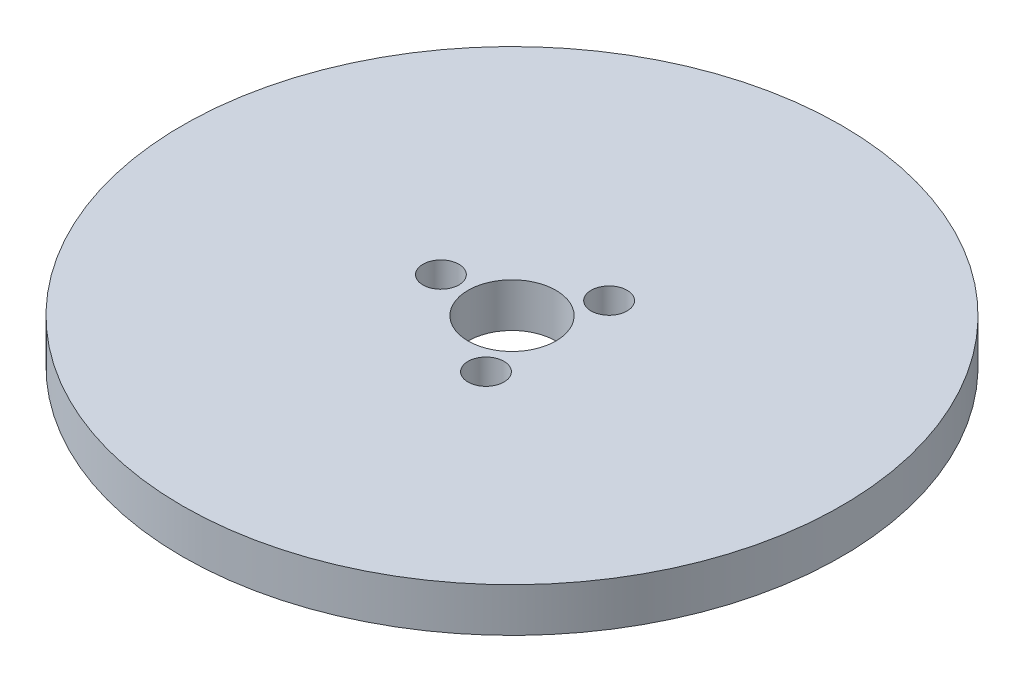
from build123d import *

# Parameters (mm, degrees)
SKETCH1_R           = 75
BOSS_EXTRUDE1_DEPTH = 10
SKETCH2_R           = 10
CUT_EXTRUDE1_DEPTH  = 107.536378763
SKETCH3_R           = 4.093814482
CUT_EXTRUDE2_DEPTH  = 6.041409129
CIRPATTERN1_COUNT   = 3


with BuildPart() as part:
    # Sketch1 → Boss-Extrude1 (new body)
    with BuildSketch(Plane(origin=(0, 0, 0), x_dir=(1, 0, 0), z_dir=(0, 1, 0))):
        Circle(SKETCH1_R)
    extrude(amount=BOSS_EXTRUDE1_DEPTH)

    # Sketch2 → Cut-Extrude1 (cut, through all)
    with BuildSketch(Plane(origin=(0, 0, 0), x_dir=(1, 0, 0), z_dir=(0, 1, 0))):
        Circle(SKETCH2_R)
    extrude(amount=CUT_EXTRUDE1_DEPTH, mode=Mode.SUBTRACT)

    # Sketch3 → Cut-Extrude2 (cut)
    with BuildSketch(Plane(origin=(0, 10, 0), x_dir=(1, 0, 0), z_dir=(0, 1, 0))):
        with Locations((-16.177034973, 0)):
            Circle(SKETCH3_R)
    cut_extrude2 = extrude(amount=-CUT_EXTRUDE2_DEPTH, mode=Mode.SUBTRACT)

    # CirPattern1: Cut-Extrude2 ×3 about axis
    cirpattern1_axis = Axis((0, 0, 0), (0, 1, 0))
    for i in range(1, CIRPATTERN1_COUNT):
        add(cut_extrude2.rotate(cirpattern1_axis, i * 360 / CIRPATTERN1_COUNT), mode=Mode.SUBTRACT)


solid = part.part
